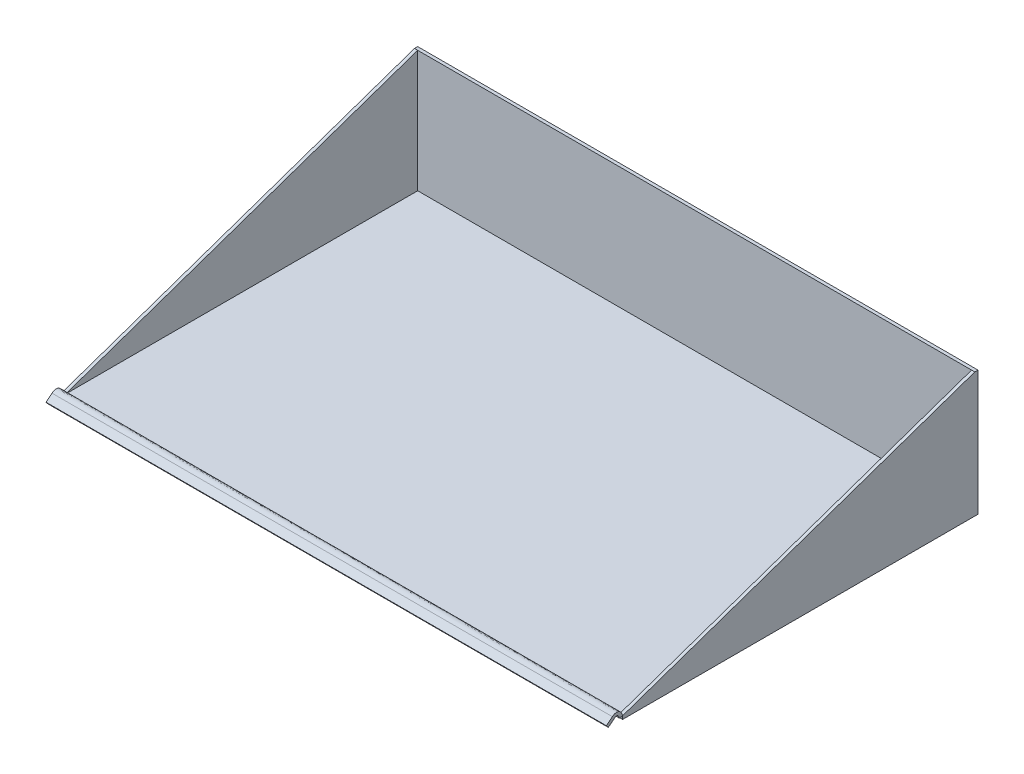
from build123d import *

# Parameters (mm, degrees)
SKETCH1_W           = 1730
SKETCH1_H           = 390
BOSS_EXTRUDE1_DEPTH = 10
SKETCH2_W           = 1730
SKETCH2_H           = 10
BOSS_EXTRUDE2_DEPTH = 1100
BOSS_EXTRUDE3_DEPTH = 10
EXTRUDE_THIN4_START = -9.999030268
EXTRUDE_THIN4_DEPTH = 1749.999030268
SKETCH7_W           = 1749.999030268
SKETCH7_H           = 10
BOSS_EXTRUDE5_DEPTH = 24.044878722


# Read off the part's stored shape, not the designer's step: Extrude-Thin4
with BuildPart() as part:
    # Sketch1 → Boss-Extrude1 (new body)
    with BuildSketch(Plane.XY):
        Rectangle(SKETCH1_W, SKETCH1_H)
    extrude(amount=BOSS_EXTRUDE1_DEPTH)

    # Sketch2 → Boss-Extrude2 (add)
    with BuildSketch(Plane.XY.offset(10)):
        with Locations((0, -190)):
            Rectangle(SKETCH2_W, SKETCH2_H)
    extrude(amount=BOSS_EXTRUDE2_DEPTH)

    # Sketch3 → Boss-Extrude3 (add)
    with BuildSketch(Plane(origin=(865, 0, 0), x_dir=(0, 0, -1), z_dir=(1, 0, 0))):
        Polygon((-1110, -185), (-10, 195), (0, 195), (0, -195), (-1110, -195), align=None)
    boss_extrude3 = extrude(amount=BOSS_EXTRUDE3_DEPTH)

    # Mirror1: Boss-Extrude3 across plane
    add(boss_extrude3.mirror(Plane(origin=(0, 0, 0), x_dir=(0, 0, 1), z_dir=(1, 0, 0))))


with BuildPart() as body_2:
    # Extrude-Thin4 outline → Extrude-Thin4 (new body)
    with BuildSketch(Plane.ZY.offset(-865).offset(EXTRUDE_THIN4_START)):
        with BuildLine():
            Line((1110, -185), (1119.878664077, -186.553060223))
            add(Edge.make_bspline(
                [(1119.878664077, -186.553060223), (1120.06973986, -185.337670476), (1120.379416846, -184.188767651), (1121.180226007, -182.08832069), (1121.671356856, -181.137567773), (1122.759100406, -179.489339069), (1123.354788202, -178.792882476), (1124.565853221, -177.671721163), (1125.178648954, -177.246987467), (1126.078975873, -176.782949501), (1126.376570147, -176.656608706), (1126.972563894, -176.453314873), (1127.270992066, -176.376195381), (1127.883195991, -176.267470575), (1128.197126391, -176.235735176), (1128.861010901, -176.222372807), (1129.211185828, -176.240740953), (1129.968413198, -176.342967966), (1130.375633591, -176.426954176), (1131.261690179, -176.684670954), (1131.740567554, -176.85857696), (1133.292558686, -177.557226078), (1134.483913132, -178.261229015), (1135.8051123, -179.30428099)],
                knots=[0, 0, 0, 0, 0.125, 0.125, 0.25, 0.25, 0.375, 0.375, 0.5, 0.5, 0.5625, 0.5625, 0.625, 0.625, 0.6875, 0.6875, 0.75, 0.75, 0.8125, 0.8125, 0.875, 0.875, 1, 1, 1, 1], degree=3))
            Line((1135.8051123, -179.30428099), (1142.001555186, -171.455453334))
            add(Edge.make_bspline(
                [(1110, -185), (1112.38195229, -169.848941357), (1126.810813816, -159.462762779), (1142.001555186, -171.455453334)],
                knots=[0, 0, 0, 0, 1, 1, 1, 1], degree=3))
        make_face()
    extrude(amount=EXTRUDE_THIN4_DEPTH)

    # Sketch7 → Boss-Extrude5 (add)
    with BuildSketch(Plane(origin=(0, -621.24218469, 786.906767274), x_dir=(1, 0, 0), z_dir=(0, -0.6196442885790174, 0.7848827655334288))):
        with Locations((-0.000484866, 568.06231084)):
            Rectangle(SKETCH7_W, SKETCH7_H)
    extrude(amount=BOSS_EXTRUDE5_DEPTH)


solid = Compound([part.part, body_2.part])
